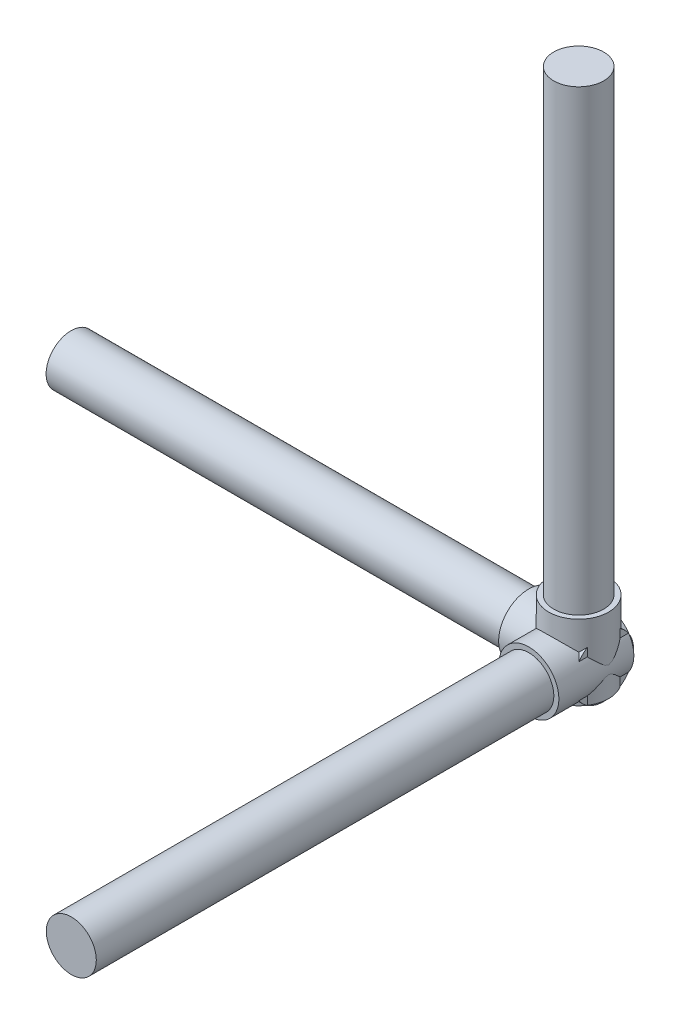
from build123d import *

# Parameters (mm, degrees)
SKETCH2_R                = 10
BOSS_EXTRUDE1_DEPTH      = 213
BODY_MOVE_COPY1_ANGLE    = 90
BODY_MOVE_COPY5_ANGLE    = 90
BOSS_EXTRUDE3_DEPTH      = 0.001
BOSS_EXTRUDE3_DEPTH_BACK = 30
SKETCH5_R                = 12
BOSS_EXTRUDE4_DEPTH      = 0.001
BOSS_EXTRUDE4_DEPTH_BACK = 30
SKETCH6_R                = 12
BOSS_EXTRUDE5_DEPTH      = 0.001
BOSS_EXTRUDE5_DEPTH_BACK = 30
SKETCH7_R                = 12
CUT_EXTRUDE13_START      = -26
SKETCH18_R               = 10
CUT_EXTRUDE13_DEPTH      = 26
SKETCH10_R               = 10
CUT_EXTRUDE14_DEPTH      = 26
SKETCH17_R               = 10
CUT_EXTRUDE15_DEPTH      = 26
MOVE_START               = -0.001
MOVE_FACE14_DEPTH        = 1.447174511


with BuildPart() as part:
    # Sketch2 → Boss-Extrude1 (new body)
    with BuildSketch(Plane.XY):
        with Locations((-56.841449475, 4.93012572)):
            Circle(SKETCH2_R)
    extrude(amount=BOSS_EXTRUDE1_DEPTH)


with BuildPart() as body_2:
    # Body-Move/Copy1: copy of part
    add(part.part.rotate(Axis((-56.841449475, 0, 106.5), (0, 1, 0)), BODY_MOVE_COPY1_ANGLE))


with BuildPart() as body_2_1:
    # Body-Move/Copy3: moved
    add(body_2.part.moved(Location((-96.595952955, 0, -96.515712889))))


with BuildPart() as body_3:
    # Body-Move/Copy5: copy of body 2
    add(body_2_1.part.rotate(Axis((-155.570972246, 4.93012572, 0), (0, 0, -1)), BODY_MOVE_COPY5_ANGLE))


with BuildPart() as body_3_1:
    # Body-Move/Copy7: moved
    add(body_3.part.moved(Location((98.630565782, 0, -0.039213331))))


with BuildPart() as body_3_2:
    # Body-Move/Copy8: moved
    add(body_3_1.part.moved(Location((-0.022814747, 98.328010116, 0))))


with BuildPart() as body_3_3:
    # Body-Move/Copy9: moved
    add(body_3_2.part.moved(Location((0, 0.297361164, 0))))


with BuildPart() as body_4:
    # Sketch5 → Boss-Extrude3 (new, two sides: drawn at the far end of the back side and taken through both)
    with BuildSketch(Plane.XZ.offset(5.078072816).offset(-BOSS_EXTRUDE3_DEPTH_BACK)):
        with Locations((-56.963221211, 9.94507378)):
            Circle(SKETCH5_R)
    extrude(amount=BOSS_EXTRUDE3_DEPTH + BOSS_EXTRUDE3_DEPTH_BACK)


with BuildPart() as body_5:
    # Sketch6 → Boss-Extrude4 (new, two sides: drawn at the far end of the back side and taken through both)
    with BuildSketch(Plane(origin=(-46.937402431, 0, 0), x_dir=(0, 0, -1), z_dir=(1, 0, 0)).offset(-BOSS_EXTRUDE4_DEPTH_BACK)):
        with Locations((-9.984287111, 4.93012572)):
            Circle(SKETCH6_R)
    extrude(amount=BOSS_EXTRUDE4_DEPTH + BOSS_EXTRUDE4_DEPTH_BACK)


with BuildPart() as body_6:
    # Sketch7 → Boss-Extrude5 (new, two sides: drawn at the far end of the back side and taken through both)
    with BuildSketch(Plane(origin=(0, 0, 0), x_dir=(-1, 0, 0), z_dir=(0, 0, -1)).offset(-BOSS_EXTRUDE5_DEPTH_BACK)):
        with Locations((56.841449475, 4.93012572)):
            Circle(SKETCH7_R)
    extrude(amount=BOSS_EXTRUDE5_DEPTH + BOSS_EXTRUDE5_DEPTH_BACK)


with BuildPart() as cut_extrude13_tool:
    # Sketch18 → Cut-Extrude13 (new body)
    with BuildSketch(Plane.XY.offset(30).offset(CUT_EXTRUDE13_START)):
        with Locations((-56.841449475, 4.93012572)):
            Circle(SKETCH18_R)
    extrude(amount=CUT_EXTRUDE13_DEPTH)


with BuildPart() as body_4_1:
    add(body_4.part)

    # Cut-Extrude13: cut by cut_extrude13_tool
    add(cut_extrude13_tool.part, mode=Mode.SUBTRACT)


with BuildPart() as body_5_1:
    add(body_5.part)

    # Cut-Extrude13: cut by cut_extrude13_tool
    add(cut_extrude13_tool.part, mode=Mode.SUBTRACT)


with BuildPart() as body_6_1:
    add(body_6.part)

    # Cut-Extrude13: cut by cut_extrude13_tool
    add(cut_extrude13_tool.part, mode=Mode.SUBTRACT)


with BuildPart() as cut_extrude14_tool:
    # Sketch10 → Cut-Extrude14 (new body)
    with BuildSketch(Plane(origin=(0, 24.921927184, 0), x_dir=(1, 0, 0), z_dir=(0, 1, 0))):
        with Locations(Location((-56.963221211, -9.94507378, 0), (0, 0, 180))):
            Circle(SKETCH10_R)
    extrude(amount=-CUT_EXTRUDE14_DEPTH)


with BuildPart() as body_4_2:
    add(body_4_1.part)

    # Cut-Extrude14: cut by cut_extrude14_tool
    add(cut_extrude14_tool.part, mode=Mode.SUBTRACT)


with BuildPart() as body_5_2:
    add(body_5_1.part)

    # Cut-Extrude14: cut by cut_extrude14_tool
    add(cut_extrude14_tool.part, mode=Mode.SUBTRACT)


with BuildPart() as body_6_2:
    add(body_6_1.part)

    # Cut-Extrude14: cut by cut_extrude14_tool
    add(cut_extrude14_tool.part, mode=Mode.SUBTRACT)


with BuildPart() as cut_extrude15_tool:
    # Sketch17 → Cut-Extrude15 (new body)
    with BuildSketch(Plane.ZY.offset(76.937402431)):
        with Locations((9.984287111, 4.93012572)):
            Circle(SKETCH17_R)
    extrude(amount=-CUT_EXTRUDE15_DEPTH)


with BuildPart() as body_4_3:
    add(body_4_2.part)

    # Cut-Extrude15: cut by cut_extrude15_tool
    add(cut_extrude15_tool.part, mode=Mode.SUBTRACT)


with BuildPart() as body_5_3:
    add(body_5_2.part)

    # Cut-Extrude15: cut by cut_extrude15_tool
    add(cut_extrude15_tool.part, mode=Mode.SUBTRACT)


with BuildPart() as body_6_3:
    add(body_6_2.part)

    # Cut-Extrude15: cut by cut_extrude15_tool
    add(cut_extrude15_tool.part, mode=Mode.SUBTRACT)

    # Move Face14: read off the stored shape, not the designer's step
    # Move Face14 outline → Move Face14 (cut)
    with BuildSketch(Plane.XY.offset(MOVE_START)):
        with BuildLine():
            ThreePointArc((-58.000340471, 16.874035116), (-65.542479088, 13.194028168), (-68.829191494, 5.472381478))
            Line((-68.829191494, 5.472381478), (-58.000340471, 5.472381478))
            Line((-58.000340471, 5.472381478), (-58.000340471, 16.874035116))
        make_face()
    extrude(amount=MOVE_FACE14_DEPTH, mode=Mode.SUBTRACT)


solid = Compound([part.part, body_2_1.part, body_3_3.part, body_4_3.part, body_5_3.part, body_6_3.part])
